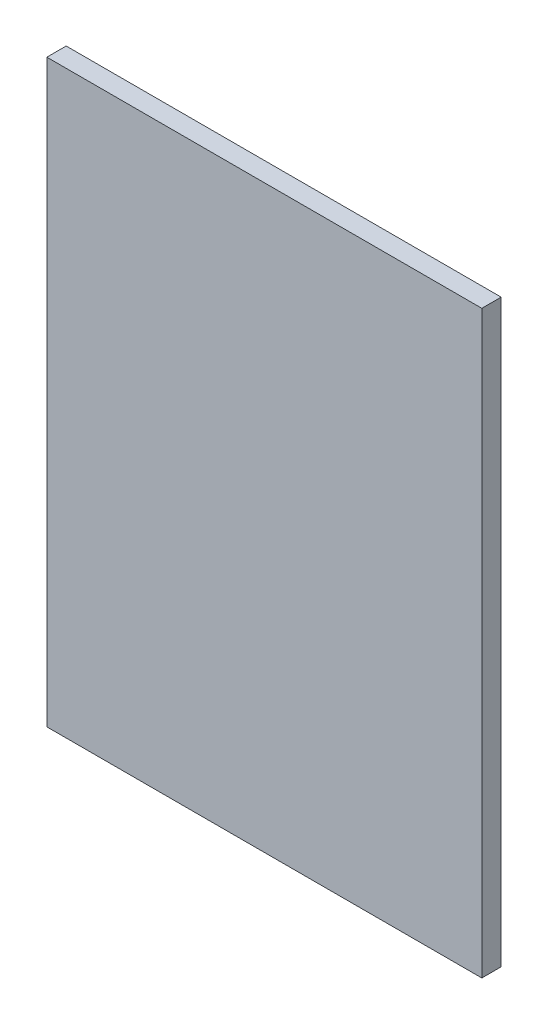
from build123d import *

# Parameters (mm, degrees)
SKETCH1_W           = 225
SKETCH1_H           = 300
BOSS_EXTRUDE1_DEPTH = 10


with BuildPart() as part:
    # Sketch1 → Boss-Extrude1 (new body)
    with BuildSketch(Plane.XY):
        Rectangle(SKETCH1_W, SKETCH1_H)
    extrude(amount=BOSS_EXTRUDE1_DEPTH)


solid = part.part
